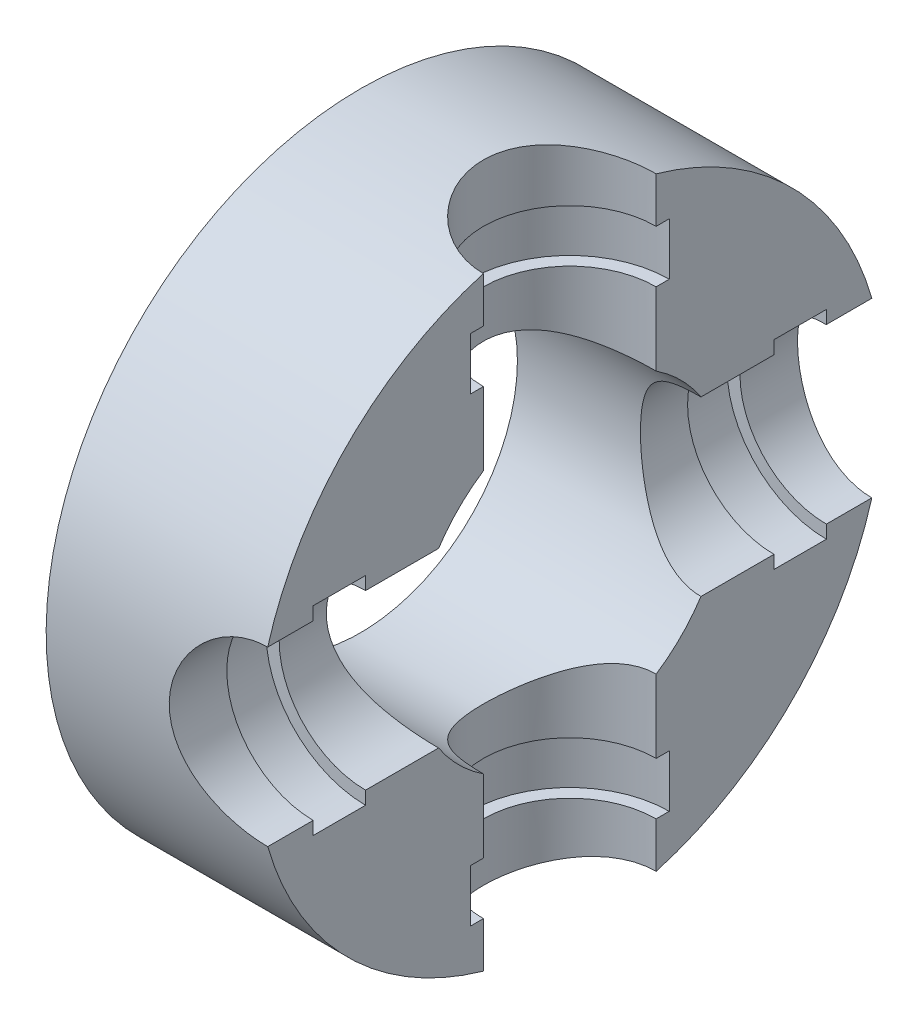
from build123d import *

# Parameters (mm, degrees)
SKETCH1_R           = 30
SKETCH1_R_2         = 15
BOSS_EXTRUDE1_DEPTH = 40
SKETCH3_R           = 9.5
CUT_EXTRUDE1_DEPTH  = 2.5
SKETCH4_R           = 8.25
CUT_EXTRUDE2_DEPTH  = 15
CIRPATTERN1_COUNT   = 4


# Read off the part's stored shape, not the designer's step: Body-Delete/Keep 1
with BuildPart() as part:
    # Sketch1 → Boss-Extrude1 (new body)
    with BuildSketch(Plane(origin=(0, 0, 0), x_dir=(0, 0, -1), z_dir=(1, 0, 0))):
        Circle(SKETCH1_R)
        Circle(SKETCH1_R_2, mode=Mode.SUBTRACT)
    extrude(amount=BOSS_EXTRUDE1_DEPTH)

    # Sketch3 → Cut-Extrude1 (cut, symmetric)
    with BuildSketch(Plane.XY.offset(22)):
        with Locations((20, 0)):
            Circle(SKETCH3_R)
    cut_extrude1 = extrude(amount=CUT_EXTRUDE1_DEPTH, both=True, mode=Mode.SUBTRACT)

    # Sketch4 → Cut-Extrude2 (cut, symmetric)
    with BuildSketch(Plane.XY.offset(22)):
        with Locations((20, 0)):
            Circle(SKETCH4_R)
    cut_extrude2 = extrude(amount=CUT_EXTRUDE2_DEPTH, both=True, mode=Mode.SUBTRACT)

    # CirPattern1: Cut-Extrude1, Cut-Extrude2 ×4 about axis
    cirpattern1_axis = Axis((0, 0, 0), (1, 0, 0))
    add([cut_extrude1.rotate(cirpattern1_axis, i * 360 / CIRPATTERN1_COUNT) for i in range(1, CIRPATTERN1_COUNT)], mode=Mode.SUBTRACT)
    add([cut_extrude2.rotate(cirpattern1_axis, i * 360 / CIRPATTERN1_COUNT) for i in range(1, CIRPATTERN1_COUNT)], mode=Mode.SUBTRACT)


with BuildPart() as body_2:
    # Split1: the piece on the far side of the plane
    add(part.part)
    split(bisect_by=Plane(origin=(20, 0, 0), x_dir=(0, 0, 1), z_dir=(1, 0, 0)), keep=Keep.BOTTOM)


with BuildPart() as part_1:
    add(part.part)

    # Split1
    split(bisect_by=Plane(origin=(20, 0, 0), x_dir=(0, 0, 1), z_dir=(1, 0, 0)), keep=Keep.TOP)


solid = body_2.part
